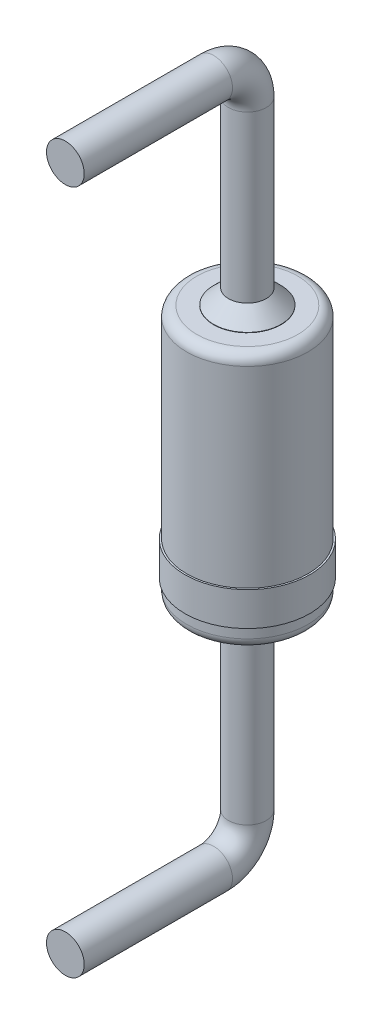
from build123d import *

# Parameters (mm, degrees)
SKETCH1_R           = 0.9
BOSS_EXTRUDE1_DEPTH = 3.8
SKETCH2_R           = 0.5
BOSS_EXTRUDE2_DEPTH = 0.225
CHAMFER2_SIZE       = 0.22
FILLET1_R           = 0.15
FILLET2_R           = 0.15
SKETCH10_R          = 0.925
SKETCH10_R_2        = 0.875
BOSS_EXTRUDE9_DEPTH = 0.5
BARRER1_OUTLINE_R   = 0.28
BARRER1_ANGLE       = 90
BARRER1_START       = -2.6800001
BARRER1_2_OUTLINE_R = 0.28
BARRER1_2_DEPTH     = 2.4550001
BARRER1_START_2     = 0.4999999
BARRER1_3_OUTLINE_R = 0.28
BARRER1_3_DEPTH     = 2.2000001
BARRER2_OUTLINE_R   = 0.28
BARRER2_ANGLE       = 90
BARRER2_START       = 4.025
BARRER2_2_OUTLINE_R = 0.28
BARRER2_2_DEPTH     = 2.4550001
BARRER2_START_2     = 0.4999999
BARRER2_3_OUTLINE_R = 0.28
BARRER2_3_DEPTH     = 2.2000001


with BuildPart() as part:
    # Sketch1 → Boss-Extrude1 (new body)
    with BuildSketch(Plane(origin=(0, 0, 0), x_dir=(1, 0, 0), z_dir=(0, 1, 0))):
        with Locations(Location((0, 0, 0), (0, 0, 90))):
            Circle(SKETCH1_R)
    extrude(amount=BOSS_EXTRUDE1_DEPTH)

    # Fillet1
    fillet1_edges = [part.edges().sort_by_distance(p)[0] for p in [
        (0, 3.8, 0.9),
    ]]
    fillet(fillet1_edges, radius=FILLET1_R)

    # Fillet2
    fillet2_edges = [part.edges().sort_by_distance(p)[0] for p in [
        (0, 0, 0.9),
    ]]
    fillet(fillet2_edges, radius=FILLET2_R)


with BuildPart() as body_2:
    # Sketch2 → Boss-Extrude2 (new body)
    with BuildSketch(Plane(origin=(0, 3.8, 0), x_dir=(1, 0, 0), z_dir=(0, 1, 0))):
        with Locations(Location((0, 0, 0), (0, 0, 270))):
            Circle(SKETCH2_R)
    extrude(amount=BOSS_EXTRUDE2_DEPTH)

    # Chamfer2
    chamfer2_edges = [body_2.edges().sort_by_distance(p)[0] for p in [
        (0, 4.025, -0.5),
    ]]
    chamfer(chamfer2_edges, length=CHAMFER2_SIZE)


with BuildPart() as body_3:
    # Mirror1: mirrored copy
    add(body_2.part.mirror(Plane.ZX.offset(1.9)))

    # Barrer1: read off the stored shape, not the designer's step
    # Barrer1 outline → Barrer1 (revolve)
    with BuildSketch(Plane(origin=(0, -2.68, 0.5), x_dir=(0, -1, 0), z_dir=(0, 0, 1))):
        with Locations((0.5, 0)):
            Circle(BARRER1_OUTLINE_R)
    revolve(axis=Axis((0, -2.68, 0.5), (1, 0, 0)), revolution_arc=BARRER1_ANGLE)

    # Barrer1 2 outline → Barrer1 2 (add)
    with BuildSketch(Plane(origin=(0, 0, 0), x_dir=(1, 0, 0), z_dir=(0, 1, 0)).offset(BARRER1_START)):
        Circle(BARRER1_2_OUTLINE_R)
    extrude(amount=BARRER1_2_DEPTH)

    # Barrer1 3 outline → Barrer1 3 (add)
    with BuildSketch(Plane.XY.offset(BARRER1_START_2)):
        with Locations((0, -3.18)):
            Circle(BARRER1_3_OUTLINE_R)
    extrude(amount=BARRER1_3_DEPTH)


with BuildPart() as body_4:
    # Sketch10 → Boss-Extrude9 (new body)
    with BuildSketch(Plane(origin=(0, 0.8, 0), x_dir=(-1, 0, 0), z_dir=(0, 1, 0))):
        with Locations(Location((0, 0, 0), (0, 0, 90))):
            Circle(SKETCH10_R)
        with Locations(Location((0, 0, 0), (0, 0, 90))):
            Circle(SKETCH10_R_2, mode=Mode.SUBTRACT)
    extrude(amount=-BOSS_EXTRUDE9_DEPTH)


with BuildPart() as body_2_1:
    add(body_2.part)

    # Barrer2: read off the stored shape, not the designer's step
    # Barrer2 outline → Barrer2 (revolve)
    with BuildSketch(Plane(origin=(0, 6.48, 0.5), x_dir=(0, 0, -1), z_dir=(0, -1, 0))):
        with Locations((0.5, 0)):
            Circle(BARRER2_OUTLINE_R)
    revolve(axis=Axis((0, 6.48, 0.5), (1, 0, 0)), revolution_arc=BARRER2_ANGLE)

    # Barrer2 2 outline → Barrer2 2 (add)
    with BuildSketch(Plane(origin=(0, 0, 0), x_dir=(1, 0, 0), z_dir=(0, 1, 0)).offset(BARRER2_START)):
        Circle(BARRER2_2_OUTLINE_R)
    extrude(amount=BARRER2_2_DEPTH)

    # Barrer2 3 outline → Barrer2 3 (add)
    with BuildSketch(Plane.XY.offset(BARRER2_START_2)):
        with Locations((0, 6.98)):
            Circle(BARRER2_3_OUTLINE_R)
    extrude(amount=BARRER2_3_DEPTH)


solid = Compound([part.part, body_3.part, body_4.part, body_2_1.part])
